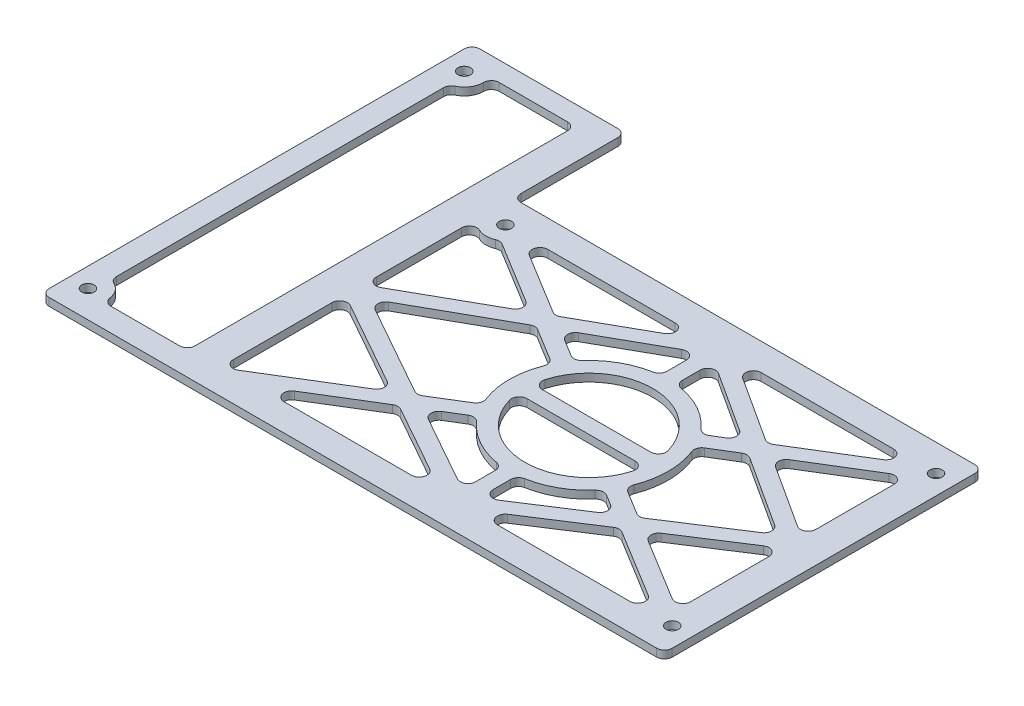
from build123d import *

# Parameters (mm, degrees)
EXTRUDE_1_DEPTH       = 2
SKETCH_2_R            = 1.6
CUT_EXTRUDE_1_DEPTH   = 2
CUT_EXTRUDE_2_DEPTH   = 10
EXTRUDE_START         = -2
EXTRUDE_1_2_OUTLINE_R = 16.5
EXTRUDE_1_2_DEPTH     = 2
SKETCH_5_R            = 1.6
CUT_EXTRUDE_3_DEPTH   = 2
FILLET_1_R            = 2
FILLET_2_R            = 2
SKETCH_6_W            = 33
SKETCH_6_H            = 4
EXTRUDE_2_DEPTH       = 2
FILLET_3_R            = 2


# Read off the part's stored shape, not the designer's step: 拉伸-薄壁1
with BuildPart() as part:
    # 草图1 → Extrude 1 (new body)
    with BuildSketch(Plane(origin=(0, 0, 0), x_dir=(1, 0, 0), z_dir=(0, 1, 0))):
        Polygon((0, 0), (121, 0), (121, -82), (-39.6, -82), (-39.6, 29), (0, 29), align=None)
    extrude(amount=EXTRUDE_1_DEPTH)

    # 草图2 → 切除-拉伸1 (cut)
    with BuildSketch(Plane(origin=(0, 2, 0), x_dir=(1, 0, 0), z_dir=(0, 1, 0))):
        with Locations(Location((-34.6, -75, 0), (0, 0, 270))):
            Circle(SKETCH_2_R)
        with Locations(Location((-34.6, 22, 0), (0, 0, 270))):
            Circle(SKETCH_2_R)
        with Locations(Location((116, -75, 0), (0, 0, 270))):
            Circle(SKETCH_2_R)
        with Locations(Location((116, -7, 0), (0, 0, 270))):
            Circle(SKETCH_2_R)
        with Locations(Location((5, -7, 0), (0, 0, 270))):
            Circle(SKETCH_2_R)
    extrude(amount=-CUT_EXTRUDE_1_DEPTH, mode=Mode.SUBTRACT)

    # 草图3 → 切除-拉伸2 (cut)
    with BuildSketch(Plane(origin=(0, 2, 0), x_dir=(1, 0, 0), z_dir=(0, 1, 0))):
        with BuildLine():
            Line((-8, 24), (-30.017424305, 24))
            ThreePointArc((-30.017424305, 24), (-30.162628331, 19.695714283), (-33.6, 17.101020514))
            Line((-33.6, 17.101020514), (-33.6, -70.101020514))
            ThreePointArc((-33.6, -70.101020514), (-30.428791604, -72.243005166), (-29.701020514, -76))
            Line((-29.701020514, -76), (-8, -76))
            Line((-8, -76), (-8, 24))
        make_face()
        with BuildLine():
            ThreePointArc((10, -7), (5, -12), (0, -7))
            Line((0, -7), (0, -75))
            Line((0, -75), (111, -75))
            ThreePointArc((111, -75), (111.527864045, -72.763932023), (113, -71))
            Line((113, -71), (113, -11))
            ThreePointArc((113, -11), (111.527864045, -9.236067977), (111, -7))
            Line((111, -7), (10, -7))
        make_face()
    extrude(amount=-CUT_EXTRUDE_2_DEPTH, mode=Mode.SUBTRACT)

    # Extrude 1 2 outline → Extrude 1 2 (add)
    # profile 1 of 4: a face of its own
    with BuildSketch(Plane(origin=(0, 2, 0), x_dir=(1, 0, 0), z_dir=(0, 1, 0)).offset(EXTRUDE_START)):
        with BuildLine():
            Line((87.508781443, -59.891378935), (111.047620543, -74.311568655))
            ThreePointArc((111.047620543, -74.311568655), (111.692830803, -72.460650968), (113, -71))
            Line((113, -71), (113, -70.81670339))
            Line((113, -70.81670339), (91.231047509, -57.480768531))
            Line((91.231047509, -57.480768531), (113, -43.382780251))
            Line((113, -43.382780251), (113, -38.617219749))
            Line((113, -38.617219749), (91.231047509, -24.519231469))
            Line((91.231047509, -24.519231469), (113, -11.18329661))
            Line((113, -11.18329661), (113, -11))
            ThreePointArc((113, -11), (111.692830803, -9.539349032), (111.047620543, -7.688431345))
            Line((111.047620543, -7.688431345), (87.508781443, -22.108621065))
            Line((87.508781443, -22.108621065), (64.179293034, -7))
            Line((64.179293034, -7), (56.417693677, -7))
            Line((56.417693677, -7), (31.597528439, -20.948522613))
            Line((31.597528439, -20.948522613), (9.952379457, -7.688431345))
            ThreePointArc((9.952379457, -7.688431345), (9.263558208, -9.611909533), (7.86285183, -11.099277912))
            Line((7.86285183, -11.099277912), (27.603885339, -23.192884025))
            Line((27.603885339, -23.192884025), (0, -38.705811323))
            Line((0, -38.705811323), (0, -43.294188677))
            Line((0, -43.294188677), (27.603885339, -58.807115975))
            Line((27.603885339, -58.807115975), (1.171383475, -75))
            Line((1.171383475, -75), (8.828616525, -75))
            Line((8.828616525, -75), (31.597528439, -61.051477387))
            Line((31.597528439, -61.051477387), (56.417693677, -75))
            Line((56.417693677, -75), (64.179293034, -75))
            Line((64.179293034, -75), (87.508781443, -59.891378935))
        make_face()
        with BuildLine():
            Line((35.503873282, -58.658401266), (44.147565445, -53.363166428))
            ThreePointArc((44.147565445, -53.363166428), (50.482041032, -58.885482887), (58.5, -61.402205763))
            Line((58.5, -61.402205763), (58.5, -71.581844381))
            Line((58.5, -71.581844381), (35.503873282, -58.658401266))
        make_face(mode=Mode.SUBTRACT)
        with BuildLine():
            Line((76.852434555, -53.363166428), (83.727285824, -57.574787025))
            Line((83.727285824, -57.574787025), (62.5, -71.321981654))
            Line((62.5, -71.321981654), (62.5, -61.402205763))
            ThreePointArc((62.5, -61.402205763), (70.517958968, -58.885482887), (76.852434555, -53.363166428))
        make_face(mode=Mode.SUBTRACT)
        with BuildLine():
            Line((31.510230182, -25.585960145), (42.058037819, -32.047680139))
            ThreePointArc((42.058037819, -32.047680139), (40, -41), (42.058037819, -49.952319861))
            Line((42.058037819, -49.952319861), (31.510230182, -56.414039855))
            Line((31.510230182, -56.414039855), (4.082306323, -41))
            Line((4.082306323, -41), (31.510230182, -25.585960145))
        make_face(mode=Mode.SUBTRACT)
        with BuildLine():
            Line((58.5, -10.418155619), (58.5, -20.597794237))
            ThreePointArc((58.5, -20.597794237), (50.482041032, -23.114517113), (44.147565445, -28.636833572))
            Line((44.147565445, -28.636833572), (35.503873282, -23.341598734))
            Line((35.503873282, -23.341598734), (58.5, -10.418155619))
        make_face(mode=Mode.SUBTRACT)
        with Locations((60.5, -41)):
            Circle(EXTRUDE_1_2_OUTLINE_R, mode=Mode.SUBTRACT)
        with BuildLine():
            Line((87.449551891, -26.83582338), (109.320706966, -41))
            Line((109.320706966, -41), (87.449551891, -55.16417662))
            Line((87.449551891, -55.16417662), (78.941962181, -49.952319861))
            ThreePointArc((78.941962181, -49.952319861), (81, -41), (78.941962181, -32.047680139))
            Line((78.941962181, -32.047680139), (87.449551891, -26.83582338))
        make_face(mode=Mode.SUBTRACT)
        with BuildLine():
            ThreePointArc((76.852434555, -28.636833572), (70.517958968, -23.114517113), (62.5, -20.597794237))
            Line((62.5, -20.597794237), (62.5, -10.678018346))
            Line((62.5, -10.678018346), (83.727285824, -24.425212975))
            Line((83.727285824, -24.425212975), (76.852434555, -28.636833572))
        make_face(mode=Mode.SUBTRACT)
    # profile 2 of 4: a face of its own
    with BuildSketch(Plane(origin=(0, 2, 0), x_dir=(1, 0, 0), z_dir=(0, 1, 0)).offset(EXTRUDE_START)):
        with BuildLine():
            Line((115.16418895, -76.364338627), (116.83581105, -73.635661373))
            ThreePointArc((116.83581105, -73.635661373), (114.635661373, -74.16418895), (115.16418895, -76.364338627))
        make_face()
    # profile 3 of 4: a face of its own
    with BuildSketch(Plane(origin=(0, 2, 0), x_dir=(1, 0, 0), z_dir=(0, 1, 0)).offset(EXTRUDE_START)):
        with BuildLine():
            Line((116.83581105, -8.364338627), (115.16418895, -5.635661373))
            ThreePointArc((115.16418895, -5.635661373), (114.635661373, -7.83581105), (116.83581105, -8.364338627))
        make_face()
    # profile 4 of 4: a face of its own
    with BuildSketch(Plane(origin=(0, 2, 0), x_dir=(1, 0, 0), z_dir=(0, 1, 0)).offset(EXTRUDE_START)):
        with BuildLine():
            Line((5.83581105, -5.635661373), (4.16418895, -8.364338627))
            ThreePointArc((4.16418895, -8.364338627), (6.364338627, -7.83581105), (5.83581105, -5.635661373))
        make_face()
    extrude(amount=EXTRUDE_1_2_DEPTH)

    # 草图5 → 切除-拉伸3 (cut)
    with BuildSketch(Plane(origin=(0, 2, 0), x_dir=(1, 0, 0), z_dir=(0, 1, 0))):
        with Locations(Location((116, -75, 0), (0, 0, 270))):
            Circle(SKETCH_5_R)
        with Locations(Location((116, -7, 0), (0, 0, 270))):
            Circle(SKETCH_5_R)
        with Locations(Location((5, -7, 0), (0, 0, 270))):
            Circle(SKETCH_5_R)
        Polygon((1.171383475, -75), (0, -75.717604291), (0, -75), align=None)
        Polygon((9.952379457, -7.688431345), (8.828616525, -7), (10, -7), (10.204957063, -7.513689319), align=None)
        Polygon((111, -7), (112.171383475, -7), (111.047620543, -7.688431345), (110.264993828, -7.459277871), align=None)
        Polygon((111.047620543, -74.311568655), (112.171383475, -75), (111, -75), (109.825525136, -74.655784327), align=None)
    extrude(amount=-CUT_EXTRUDE_3_DEPTH, mode=Mode.SUBTRACT)

    # 圆角1
    fillet_1_edges = [part.edges().sort_by_distance(p)[0] for p in [
        (0, 1, 38.705811323),
        (0, 1, 43.294188677),
        (8.828616525, 1, 75),
        (64.179293034, 1, 75),
        (56.417693677, 1, 75),
        (113, 1, 43.382780251),
        (113, 1, 38.617219749),
        (113, 1, 11.18329661),
        (113, 1, 70.81670339),
        (64.179293034, 1, 7),
        (56.417693677, 1, 7),
        (7.86285183, 1, 11.099277912),
        (31.597528439, 1, 61.051477387),
        (27.603885339, 1, 58.807115975),
        (27.603885339, 1, 23.192884025),
        (35.503873282, 1, 58.658401266),
        (35.503873282, 1, 23.341598734),
        (4.082306323, 1, 41),
        (31.597528439, 1, 20.948522613),
        (87.449551891, 1, 55.16417662),
        (109.320706966, 1, 41),
        (91.231047509, 1, 24.519231469),
        (91.231047509, 1, 57.480768531),
        (87.449551891, 1, 26.83582338),
        (78.941962181, 1, 49.952319861),
        (78.941962181, 1, 32.047680139),
        (76.852434555, 1, 53.363166428),
        (76.852434555, 1, 28.636833572),
        (87.508781443, 1, 22.108621065),
        (87.508781443, 1, 59.891378935),
        (62.5, 1, 20.597794237),
        (62.5, 1, 61.402205763),
        (83.727285824, 1, 57.574787025),
        (83.727285824, 1, 24.425212975),
        (44.147565445, 1, 53.363166428),
        (62.5, 1, 71.321981654),
        (58.5, 1, 71.581844381),
        (58.5, 1, 61.402205763),
        (31.510230182, 1, 56.414039855),
        (42.058037819, 1, 49.952319861),
        (44.147565445, 1, 28.636833572),
        (62.5, 1, 10.678018346),
        (58.5, 1, 10.418155619),
        (58.5, 1, 20.597794237),
        (31.510230182, 1, 25.585960145),
        (42.058037819, 1, 32.047680139),
        (0, 1, 75.717604291),
        (112.171383475, 1, 75),
        (112.171383475, 1, 7),
        (8.828616525, 1, 7),
        (-29.701020514, 1, 76),
        (-33.6, 1, 70.101020514),
        (-33.6, 1, -17.101020514),
        (-30.017424305, 1, -24),
        (-8, 1, -24),
        (-8, 1, 76),
        (0, 1, 7),
    ]]
    fillet(fillet_1_edges, radius=FILLET_1_R)

    # 圆角2
    fillet_2_edges = [part.edges().sort_by_distance(p)[0] for p in [
        (0, 1, 0),
        (121, 1, 0),
        (121, 1, 82),
        (-39.6, 1, 82),
        (-39.6, 1, -29),
        (0, 1, -29),
    ]]
    fillet(fillet_2_edges, radius=FILLET_2_R)

    # 草图6 → 拉伸-薄壁2 (add)
    with BuildSketch(Plane(origin=(0, 2, 0), x_dir=(1, 0, 0), z_dir=(0, 1, 0))):
        with Locations((60.5, -41)):
            Rectangle(SKETCH_6_W, SKETCH_6_H)
    extrude(amount=-EXTRUDE_2_DEPTH)

    # 圆角3
    fillet_3_edges = [part.edges().sort_by_distance(p)[0] for p in [
        (44.121660646, 1, 39),
        (76.878339354, 1, 39),
        (44.121660646, 1, 43),
        (76.878339354, 1, 43),
    ]]
    fillet(fillet_3_edges, radius=FILLET_3_R)


solid = part.part
